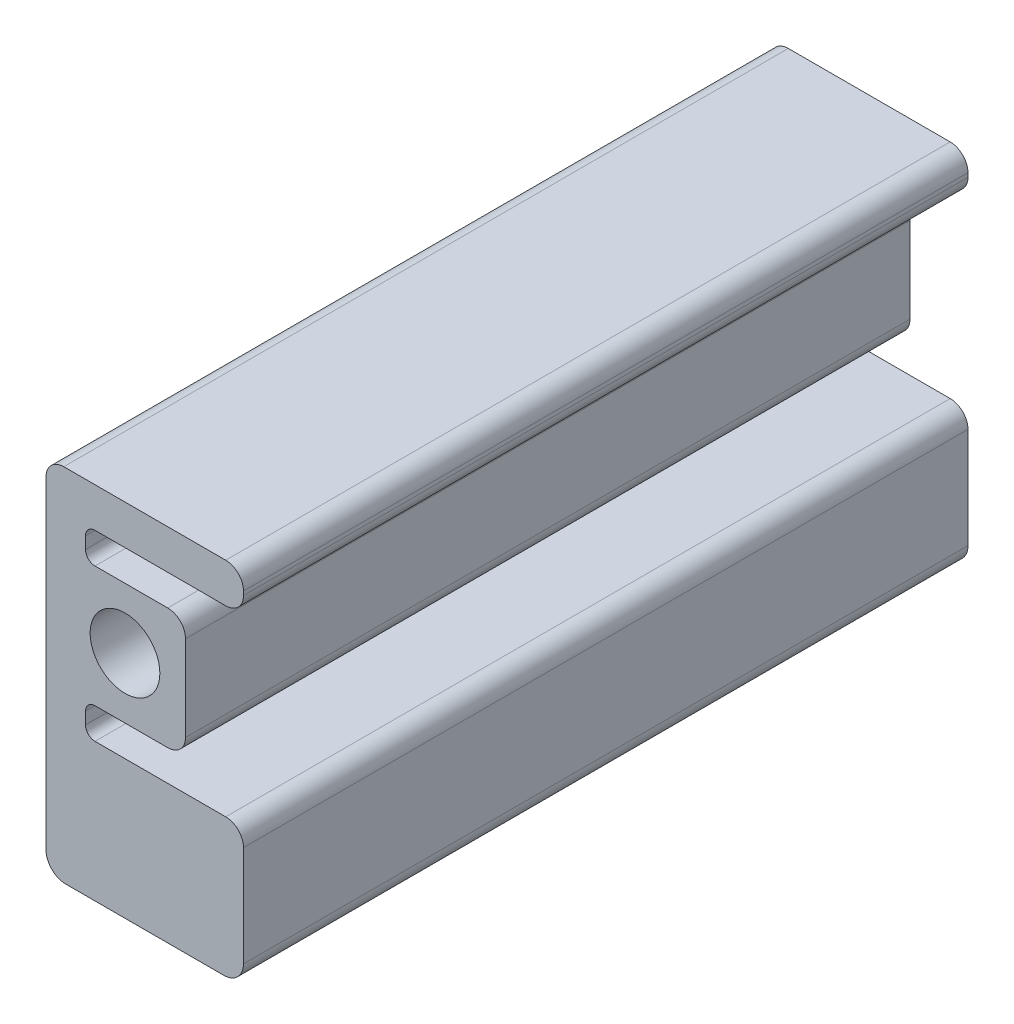
from build123d import *

# Parameters (mm, degrees)
SKETCH1_R           = 11.2
BOSS_EXTRUDE1_DEPTH = 232.947291788


with BuildPart() as part:
    # Sketch1 → Boss-Extrude1 (new body)
    with BuildSketch(Plane.XY):
        with BuildLine():
            Line((-25.4, -67.479999962), (-25.4, 36.365))
            ThreePointArc((-25.4, 36.365), (-23.726115254, 40.406115254), (-19.685, 42.08))
            Line((-19.685, 42.08), (32.385, 42.08))
            ThreePointArc((32.385, 42.08), (36.426115254, 40.406115254), (38.1, 36.365))
            Line((38.1, 36.365), (38.1, 35.095))
            ThreePointArc((38.1, 35.095), (36.426115254, 31.053884746), (32.385, 29.38))
            Line((32.385, 29.38), (-9.652, 29.38))
            ThreePointArc((-9.652, 29.38), (-11.807261469, 28.487261469), (-12.7, 26.332))
            Line((-12.7, 26.332), (-12.7, 22.503))
            ThreePointArc((-12.7, 22.503), (-11.807261469, 20.347738531), (-9.652, 19.455))
            Line((-9.652, 19.455), (0, 19.455))
            Line((0, 19.455), (13.74, 19.455))
            ThreePointArc((13.74, 19.455), (17.781115254, 17.781115254), (19.455, 13.74))
            Line((19.455, 13.74), (19.455, 0))
            Line((19.455, 0), (19.455, -13.74))
            ThreePointArc((19.455, -13.74), (17.781115254, -17.781115254), (13.74, -19.455))
            Line((13.74, -19.455), (0, -19.455))
            Line((0, -19.455), (-9.652, -19.455))
            ThreePointArc((-9.652, -19.455), (-11.807261469, -20.347738531), (-12.7, -22.503))
            Line((-12.7, -22.503), (-12.7, -26.331999962))
            ThreePointArc((-12.7, -26.331999962), (-11.807261469, -28.487261431), (-9.652, -29.379999962))
            Line((-9.652, -29.379999962), (32.385, -29.379999962))
            ThreePointArc((32.385, -29.379999962), (36.426115254, -31.053884708), (38.1, -35.094999962))
            Line((38.1, -35.094999962), (38.1, -67.479999962))
            ThreePointArc((38.1, -67.479999962), (36.240128061, -71.970128023), (31.75, -73.829999962))
            Line((31.75, -73.829999962), (-19.05, -73.829999962))
            ThreePointArc((-19.05, -73.829999962), (-23.540128061, -71.970128023), (-25.4, -67.479999962))
        make_face()
        Circle(SKETCH1_R, mode=Mode.SUBTRACT)
    extrude(amount=BOSS_EXTRUDE1_DEPTH)


solid = part.part
